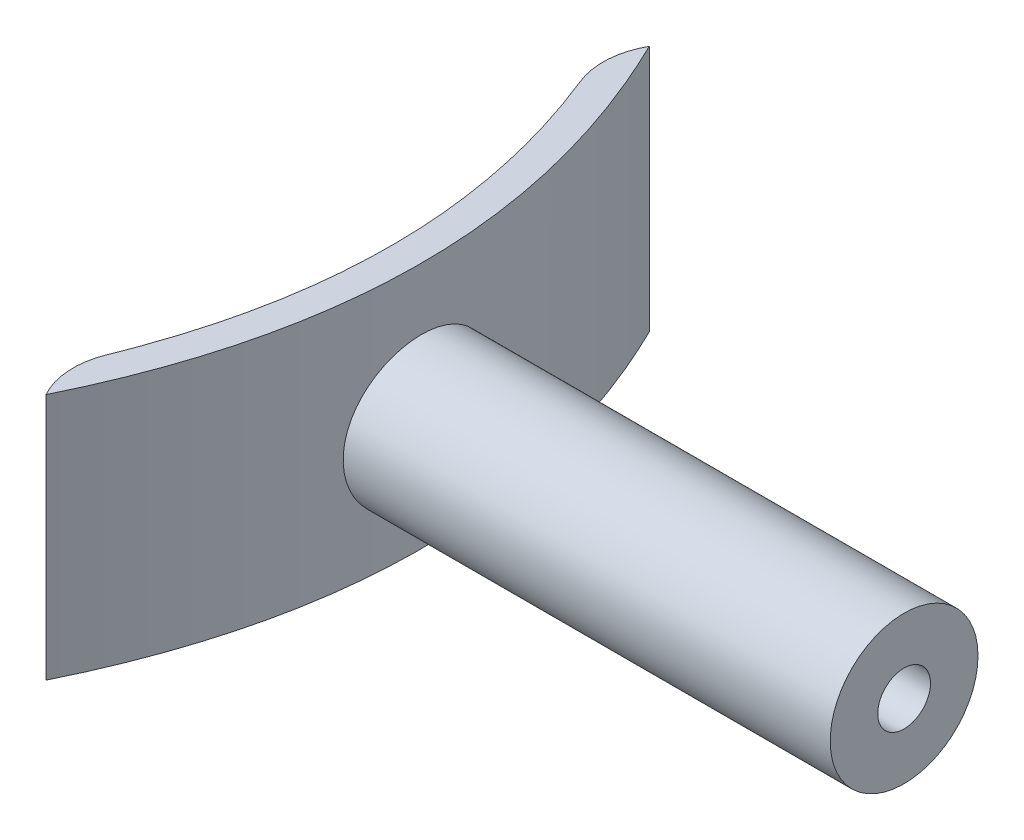
from build123d import *

# Parameters (mm, degrees)
BOSS_EXTRUDE1_DEPTH = 18
BOSS_EXTRUDE2_REACH = 30.6
SKETCH2_R           = 4.9
BOSS_EXTRUDE3_START = 29
SKETCH3_R           = 4.9
BOSS_EXTRUDE3_DEPTH = 29
SKETCH4_R           = 1.75
CUT_EXTRUDE1_DEPTH  = 29
SKETCH5_W           = 40.000265569
SKETCH5_H           = 1.6
CUT_EXTRUDE2_DEPTH  = 40
FILLET1_R           = 5


with BuildPart() as part:
    # Sketch1 → Boss-Extrude1 (new body)
    with BuildSketch(Plane(origin=(0, 0, 0), x_dir=(1, 0, 0), z_dir=(0, 1, 0))):
        with BuildLine():
            Line((8.3059154, -19.120265102), (10.102040816, -20))
            add(Edge.make_bspline(
                [(10.101910741, 20.000265569), (13.36730358, 13.333510379), (16.63267474, 8.8523e-05), (13.367346939, -13.333333333), (10.102040816, -20)],
                knots=[0.21428192, 0.21428192, 0.21428192, 0.21428192, 0.5, 0.785714286, 0.785714286, 0.785714286, 0.785714286], degree=3))
            Line((10.101910741, 20.000265569), (8.30578994, 19.12052125))
            add(Edge.make_bspline(
                [(8.30578994, 19.12052125), (8.694326407, 18.327269829), (9.438931208, 16.706587132), (10.709549512, 13.511731918), (11.931546391, 9.520297592), (12.805878251, 4.755507519), (13.097053142, 0.000126231), (12.80590918, -4.755254756), (11.931608442, -9.520044011), (10.709637835, -13.511477312), (9.43904063, -16.706331706), (8.694446639, -18.327013824), (8.3059154, -19.120265102)],
                knots=[0.21428192, 0.21428192, 0.21428192, 0.21428192, 0.249996443, 0.285710966, 0.357140012, 0.428569057, 0.499998103, 0.571427149, 0.642856194, 0.71428524, 0.749999763, 0.785714286, 0.785714286, 0.785714286, 0.785714286], degree=3))
        make_face()
    extrude(amount=BOSS_EXTRUDE1_DEPTH)

    # Sketch2 → Boss-Extrude2 (add, up to next)
    with BuildSketch(Plane(origin=(18, 0, 0), x_dir=(0, 0, -1), z_dir=(1, 0, 0)), mode=Mode.PRIVATE) as boss_extrude2_sk1:
        with Locations((0, 9)):
            Circle(SKETCH2_R)
    boss_extrude2_tool1 = extrude(boss_extrude2_sk1.sketch, amount=-BOSS_EXTRUDE2_REACH, mode=Mode.PRIVATE) - part.part
    add(boss_extrude2_tool1.solids().sort_by_distance((18, 9, 0))[0])

    # Sketch3 → Boss-Extrude3 (add)
    with BuildSketch(Plane(origin=(18, 0, 0), x_dir=(0, 0, -1), z_dir=(1, 0, 0)).offset(BOSS_EXTRUDE3_START)):
        with Locations((0, 9)):
            Circle(SKETCH3_R)
    extrude(amount=-BOSS_EXTRUDE3_DEPTH)

    # Sketch4 → Cut-Extrude1 (cut)
    with BuildSketch(Plane(origin=(47, 0, 0), x_dir=(0, 0, -1), z_dir=(1, 0, 0))):
        with Locations((0, 9)):
            Circle(SKETCH4_R)
    extrude(amount=-CUT_EXTRUDE1_DEPTH, mode=Mode.SUBTRACT)

    # Sketch5 → Cut-Extrude2 (cut)
    with BuildSketch(Plane(origin=(47, 0, 0), x_dir=(0, 0, -1), z_dir=(1, 0, 0))):
        with Locations((0.000132784, 0.8)):
            Rectangle(SKETCH5_W, SKETCH5_H)
    extrude(amount=-CUT_EXTRUDE2_DEPTH, mode=Mode.SUBTRACT)

    # Fillet1
    # the kernel refuses this fillet: 5 mm, written as the material it takes off along each edge
    with BuildSketch(Plane(origin=(8.30578994, -7.764782929, -19.12052125), x_dir=(0.4075991497748225, 0, 0.9131609568432292), z_dir=(0, 1, 0))) as fillet1_piece_1:
        with BuildLine():
            CenterArc((3.930348167, 4.996597215), FILLET1_R, 216.83934776, 51.046703295)
            Line((-0.071250852, 1.998730426), (-0.151282833, 1.93877309))
            ThreePointArc((-0.151282833, 1.93877309), (-0.135561948, 0.99580267), (-0.099936521, -0.003562543))
            Line((-0.099936521, -0.003562543), (0.003562543, -0.099936521))
            ThreePointArc((0.003562543, -0.099936521), (1.872980998, -0.066213211), (3.742224472, -0.099931944))
            Line((3.742224472, -0.099931944), (3.745913172, 0))
        make_face()
    extrude(amount=35.129565858, mode=Mode.SUBTRACT)
    with BuildSketch(Plane(origin=(8.3059154, -7.764778421, 19.120265102), x_dir=(0.8980627079890215, 0, 0.4398674488063712), z_dir=(0, 1, 0))) as fillet1_piece_2:
        with BuildLine():
            CenterArc((4.853404013, 4.105859902), FILLET1_R, 184.155597401, 51.046688752)
            Line((-0.133450663, 3.743533478), (-0.233187757, 3.736286949))
            ThreePointArc((-0.233187757, 3.736286949), (-0.132897152, 1.869432253), (-0.1, 0))
            Line((-0.1, 0), (0, -0.1))
            ThreePointArc((0, -0.1), (1, -0.1), (1.94293192, -0.082117198))
            Line((1.94293192, -0.082117198), (2, 0))
        make_face()
    extrude(amount=35.129556842, mode=Mode.SUBTRACT)


solid = part.part
